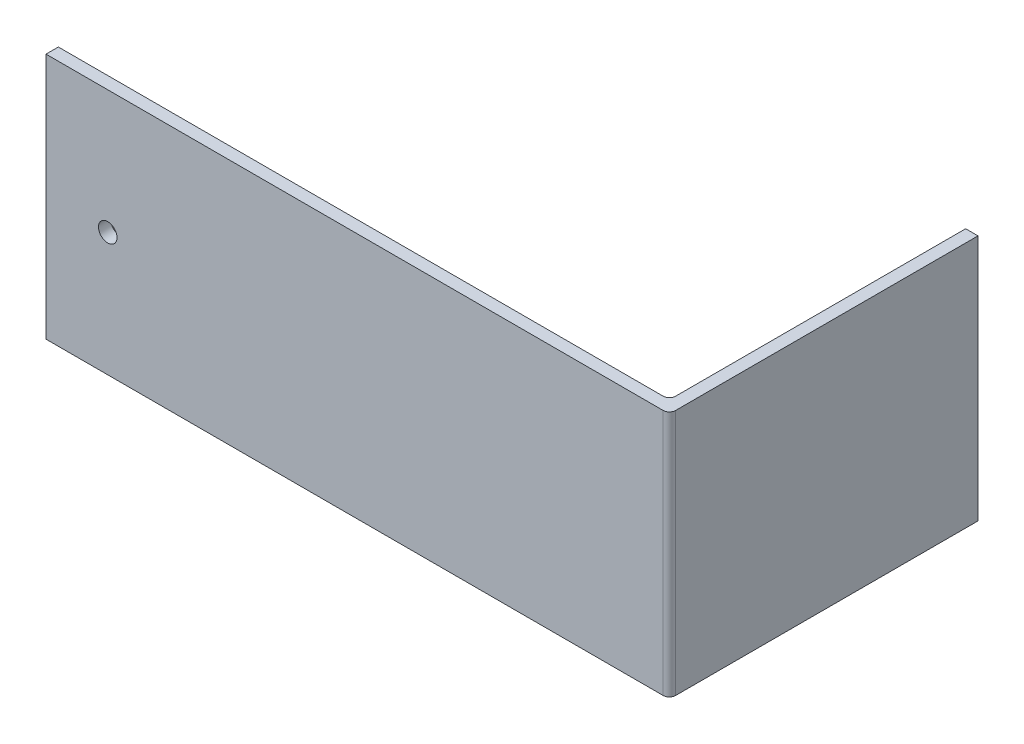
from build123d import *

# Parameters (mm, degrees)
SKETCH1_W           = 100
SKETCH1_H           = 40
SKETCH1_R           = 1.5
BOSS_EXTRUDE1_DEPTH = 2
SKETCH2_W           = 2
SKETCH2_H           = 40
BOSS_EXTRUDE3_DEPTH = 50
FILLET2_R           = 1


with BuildPart() as part:
    # Sketch1 → Boss-Extrude1 (new body)
    with BuildSketch(Plane.XY):
        with Locations((50, 20)):
            Rectangle(SKETCH1_W, SKETCH1_H)
        with Locations((10, 20)):
            Circle(SKETCH1_R, mode=Mode.SUBTRACT)
    extrude(amount=BOSS_EXTRUDE1_DEPTH)

    # Sketch2 → Boss-Extrude3 (add)
    with BuildSketch(Plane.XY.offset(2)):
        with Locations((100, 20)):
            Rectangle(SKETCH2_W, SKETCH2_H)
    extrude(amount=-BOSS_EXTRUDE3_DEPTH)

    # Fillet2
    fillet2_edges = [part.edges().sort_by_distance(p)[0] for p in [
        (101, 20, 2),
        (99, 20, 0),
    ]]
    fillet(fillet2_edges, radius=FILLET2_R)


solid = part.part
